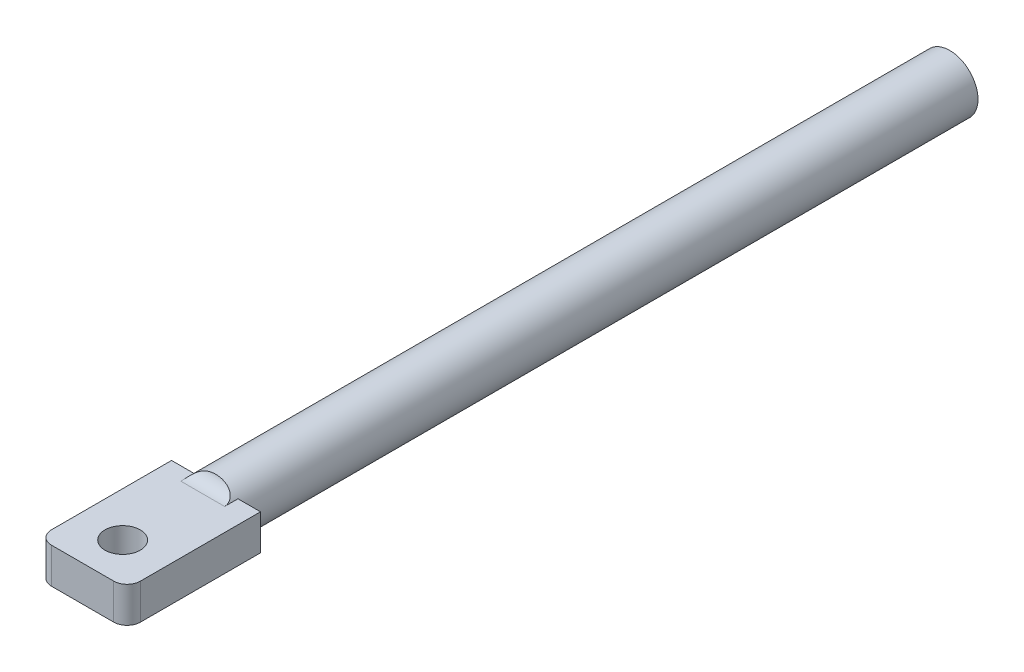
from build123d import *

# Parameters (mm, degrees)
CROQUIS1_R              = 6.35
SALIENTE_EXTRUIR1_DEPTH = 165
CROQUIS2_W              = 20
CROQUIS2_H              = 8
SALIENTE_EXTRUIR2_DEPTH = 30
REDONDEO1_R             = 3
REDONDEO2_R             = 3
CROQUIS3_R              = 3.96875
CORTAR_EXTRUIR1_DEPTH   = 30
REDONDEO3_R             = 3


with BuildPart() as part:
    # Croquis1 → Saliente-Extruir1 (new body)
    with BuildSketch(Plane.XY):
        Circle(CROQUIS1_R)
    extrude(amount=SALIENTE_EXTRUIR1_DEPTH)

    # Croquis2 → Saliente-Extruir2 (add)
    with BuildSketch(Plane.XY.offset(165)):
        Rectangle(CROQUIS2_W, CROQUIS2_H)
    extrude(amount=SALIENTE_EXTRUIR2_DEPTH)

    # Redondeo1
    # the kernel refuses this fillet: 3 mm, written as the material it adds along each edge
    with BuildSketch(Plane(origin=(12.431784667, 4, 165), x_dir=(0, 1, 0), z_dir=(-1, 0, 0))) as redondeo1_piece_1_section:
        with BuildLine():
            CenterArc((REDONDEO1_R, -REDONDEO1_R), REDONDEO1_R, 90, 90)
            Line((0, -REDONDEO1_R), (0, 0))
            Line((0, 0), (REDONDEO1_R, 0))
        make_face()
    redondeo1_piece_1 = extrude(amount=24.863569334, mode=Mode.PRIVATE)
    redondeo1_piece_1 = redondeo1_piece_1 & Plane(origin=(0, 0, 165.727834691), x_dir=(1, 0, 0), z_dir=(0, 0, -1)) * Cylinder(6.35, 62, mode=Mode.PRIVATE)
    add(redondeo1_piece_1)

    # Redondeo2
    # the kernel refuses this fillet: 3 mm, written as the material it adds along each edge
    with BuildSketch(Plane(origin=(-12.431784667, -4, 165), x_dir=(0, 0, 1), z_dir=(1, 0, 0))) as redondeo2_piece_1_section:
        with BuildLine():
            CenterArc((REDONDEO2_R, REDONDEO2_R), REDONDEO2_R, 180, 90)
            Line((0, REDONDEO2_R), (0, 0))
            Line((0, 0), (REDONDEO2_R, 0))
        make_face()
    redondeo2_piece_1 = extrude(amount=24.863569334, mode=Mode.PRIVATE)
    redondeo2_piece_1 = redondeo2_piece_1 & Plane(origin=(0, 0, 165.727832958), x_dir=(1, 0, 0), z_dir=(0, 0, -1)) * Cylinder(6.35, 62, mode=Mode.PRIVATE)
    add(redondeo2_piece_1)

    # Croquis3 → Cortar-Extruir1 (cut)
    with BuildSketch(Plane.XZ.offset(4)):
        with Locations(Location((0, 186, 0), (0, 0, 270))):
            Circle(CROQUIS3_R)
    extrude(amount=-CORTAR_EXTRUIR1_DEPTH, mode=Mode.SUBTRACT)

    # Redondeo3
    redondeo3_edges = [part.edges().sort_by_distance(p)[0] for p in [
        (10, 0, 195),
        (-10, 0, 195),
    ]]
    fillet(redondeo3_edges, radius=REDONDEO3_R)


solid = part.part
